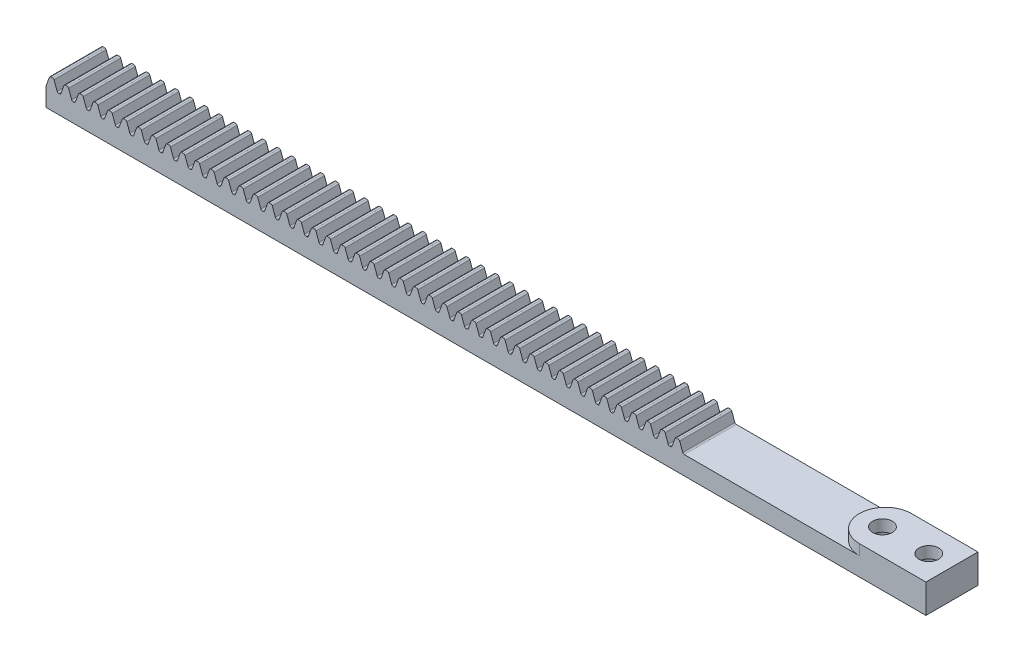
from build123d import *

# Parameters (mm, degrees)
BOSS_EXTRUDE1_DEPTH           = 4.5
BOSS_EXTRUDE1_DEPTH_BACK      = 4.5
SKETCH3_W                     = 304
SKETCH3_H                     = 5
CUT_EXTRUDE1_DEPTH            = 153.124587099
LPATTERN1_COUNT               = 44
LPATTERN1_PITCH               = 2.513274123
SKETCH5_W                     = 193.68028689
SKETCH5_H                     = 1.8
CUT_EXTRUDE2_DEPTH            = 153.324128095
M5_CLEARANCE_HOLE1_D          = 5.5
SKETCH13_W                    = 16
SKETCH13_H                    = 1.8
BOSS_EXTRUDE3_DEPTH           = 4.5
BOSS_EXTRUDE2_DEPTH           = 4.5
CBORE_FOR_M3_SHCS1_AT_2_COUNT = 2
CBORE_FOR_M3_SHCS1_AT_2_PITCH = 8
FILLET1_R                     = 1.6
FILLET3_RADIUS                = 4.5
FILLET3_LENGTH                = 3.2
FILLET4_RADIUS                = 4.5
FILLET4_LENGTH                = 1.8
FILLET2_RADIUS                = 4.5
FILLET2_LENGTH                = 3.2


# Read off the part's stored shape, not the designer's step: Split1
with BuildPart() as part:
    # Sketch3 → Boss-Extrude1 (new, two sides: drawn at the far end of the back side and taken through both)
    with BuildSketch(Plane.XY.offset(-BOSS_EXTRUDE1_DEPTH_BACK)):
        with Locations((0, -1.7)):
            Rectangle(SKETCH3_W, SKETCH3_H)
    extrude(amount=BOSS_EXTRUDE1_DEPTH + BOSS_EXTRUDE1_DEPTH_BACK)

    # Sketch4 → Cut-Extrude1 (cut, symmetric)
    with BuildSketch(Plane.XY):
        with BuildLine():
            Line((-151.409132339, 0.623395556), (-151.344853578, 0.8))
            Line((-151.344853578, 0.8), (-152.264348296, 0.8))
            Line((-152.264348296, 0.8), (-152.264348296, -1))
            Line((-152.264348296, -1), (-152.187938524, -1))
            ThreePointArc((-152.187938524, -1), (-152.033988298, -0.95145968), (-151.935721239, -0.823395556))
            Line((-151.935721239, -0.823395556), (-151.409132339, 0.623395556))
        make_face()
        with BuildLine():
            Line((-151.156915054, 0.8), (-151.344853578, 0.8))
            Line((-151.344853578, 0.8), (-151.409132339, 0.623395556))
            ThreePointArc((-151.409132339, 0.623395556), (-151.31086528, 0.75145968), (-151.156915054, 0.8))
        make_face()
        with BuildLine():
            Line((-150.606290131, 0.623395556), (-150.670568892, 0.8))
            Line((-150.670568892, 0.8), (-150.858507416, 0.8))
            ThreePointArc((-150.858507416, 0.8), (-150.70455719, 0.75145968), (-150.606290131, 0.623395556))
        make_face()
        with BuildLine():
            Line((-149.751074174, -1), (-149.751074174, 0.8))
            Line((-149.751074174, 0.8), (-150.670568892, 0.8))
            Line((-150.670568892, 0.8), (-150.606290131, 0.623395556))
            Line((-150.606290131, 0.623395556), (-150.079701231, -0.823395556))
            ThreePointArc((-150.079701231, -0.823395556), (-149.981434172, -0.95145968), (-149.827483946, -1))
            Line((-149.827483946, -1), (-149.751074174, -1))
        make_face()
    cut_extrude1 = extrude(amount=CUT_EXTRUDE1_DEPTH, both=True, mode=Mode.SUBTRACT)

    # LPattern1: Cut-Extrude1 ×44
    with Locations(*[(i * LPATTERN1_PITCH, 0, 0) for i in range(1, LPATTERN1_COUNT)]):
        add(cut_extrude1, mode=Mode.SUBTRACT)

    # Sketch5 → Cut-Extrude2 (cut, through all)
    with BuildSketch(Plane.XY.offset(4.5)):
        with Locations((55.159856555, -0.1)):
            Rectangle(SKETCH5_W, SKETCH5_H)
    extrude(amount=-CUT_EXTRUDE2_DEPTH, mode=Mode.SUBTRACT)

    # M5 Clearance Hole1 (through all)
    with Locations(Plane(origin=(0, -1, 0), x_dir=(1, 0, 0), z_dir=(0, 1, 0))):
        with Locations((146, 0)):
            Hole(M5_CLEARANCE_HOLE1_D / 2)


with BuildPart() as body_2:
    # Split1: the piece on the far side of the plane
    add(part.part)
    split(bisect_by=Plane.YZ, keep=Keep.BOTTOM)

    # Sketch13 → Boss-Extrude3 (add, symmetric)
    with BuildSketch(Plane.XY):
        with Locations((-8, -0.1)):
            Rectangle(SKETCH13_W, SKETCH13_H)
    extrude(amount=BOSS_EXTRUDE3_DEPTH, both=True)


with BuildPart() as part_1:
    add(part.part)

    # Split1
    split(bisect_by=Plane.YZ, keep=Keep.TOP)

    # Sketch9 → Boss-Extrude2 (add, symmetric)
    with BuildSketch(Plane.XY):
        Polygon((3.2, -1), (3.2, 4), (-16, 4), (-16, 0.8), (0, 0.8), (0, -1), align=None)
    extrude(amount=BOSS_EXTRUDE2_DEPTH, both=True)


with BuildPart() as cbore_for_m3_shcs1_tool:
    # Sketch11 → CBORE for M3 SHCS1 (revolve)
    with BuildSketch(Plane(origin=(-12, -4.2, 0), x_dir=(0, 0, -1), z_dir=(1, 0, 0))):
        Polygon((0, 0), (0, 8.2), (1.7, 8.2), (1.7, 3), (3.25, 3), (3.25, 0.025), (3.275, 0), align=None)
    cbore_for_m3_shcs1 = revolve(axis=Axis((-12, -10.55, 0), (0, 1, 0)))


with BuildPart() as part_2:
    add(part_1.part)

    # CBORE for M3 SHCS1: cut by cbore_for_m3_shcs1_tool
    add(cbore_for_m3_shcs1_tool.part, mode=Mode.SUBTRACT)


with BuildPart() as body_2_1:
    add(body_2.part)

    # CBORE for M3 SHCS1: cut by cbore_for_m3_shcs1_tool
    add(cbore_for_m3_shcs1_tool.part, mode=Mode.SUBTRACT)


with BuildPart() as cbore_for_m3_shcs1_at_2_tool:
    # CBORE for M3 SHCS1 at 2: CBORE for M3 SHCS1 ×2
    with Locations(*[(i * CBORE_FOR_M3_SHCS1_AT_2_PITCH, 0, 0) for i in range(1, CBORE_FOR_M3_SHCS1_AT_2_COUNT)]):
        add(cbore_for_m3_shcs1)


with BuildPart() as part_3:
    add(part_2.part)

    # CBORE for M3 SHCS1 at 2: cut by cbore_for_m3_shcs1_at_2_tool
    add(cbore_for_m3_shcs1_at_2_tool.part, mode=Mode.SUBTRACT)

    # Fillet1
    fillet1_edges = [part_3.edges().sort_by_distance(p)[0] for p in [
        (3.2, -1, 0),
        (3.2, 4, 0),
    ]]
    fillet(fillet1_edges, radius=FILLET1_R)

    # Fillet3: full round fillet: the end face becomes a half cylinder, R = half its width
    fillet3_face = Plane((-16, 2.4, 0), x_dir=(0, -1, 0), z_dir=(-1, 0, 0))  # on the end face: x along it, z out of the body
    fillet3_slab = fillet3_face.offset(-FILLET3_RADIUS / 2) * Box(FILLET3_LENGTH, 2 * FILLET3_RADIUS, FILLET3_RADIUS, mode=Mode.PRIVATE)  # the body's end, R deep
    fillet3_round = Plane((-11.5, 2.4, 0), x_dir=(-1, 0, 0), z_dir=(0, -1, 0)) * Cylinder(FILLET3_RADIUS, FILLET3_LENGTH, mode=Mode.PRIVATE)  # its axis R under the face
    add(fillet3_slab - fillet3_round, mode=Mode.SUBTRACT)

    # Fillet2: full round fillet: the end face becomes a half cylinder, R = half its width
    fillet2_face = Plane((152, -2.6, 0), x_dir=(0, -1, 0), z_dir=(1, 0, 0))  # on the end face: x along it, z out of the body
    fillet2_slab = fillet2_face.offset(-FILLET2_RADIUS / 2) * Box(FILLET2_LENGTH, 2 * FILLET2_RADIUS, FILLET2_RADIUS, mode=Mode.PRIVATE)  # the body's end, R deep
    fillet2_round = Plane((147.5, -2.6, 0), x_dir=(1, 0, 0), z_dir=(0, -1, 0)) * Cylinder(FILLET2_RADIUS, FILLET2_LENGTH, mode=Mode.PRIVATE)  # its axis R under the face
    add(fillet2_slab - fillet2_round, mode=Mode.SUBTRACT)


with BuildPart() as body_2_2:
    add(body_2_1.part)

    # CBORE for M3 SHCS1 at 2: cut by cbore_for_m3_shcs1_at_2_tool
    add(cbore_for_m3_shcs1_at_2_tool.part, mode=Mode.SUBTRACT)

    # Fillet4: full round fillet: the end face becomes a half cylinder, R = half its width
    fillet4_face = Plane((-16, -0.1, 0), x_dir=(0, -1, 0), z_dir=(-1, 0, 0))  # on the end face: x along it, z out of the body
    fillet4_slab = fillet4_face.offset(-FILLET4_RADIUS / 2) * Box(FILLET4_LENGTH, 2 * FILLET4_RADIUS, FILLET4_RADIUS, mode=Mode.PRIVATE)  # the body's end, R deep
    fillet4_round = Plane((-11.5, -0.1, 0), x_dir=(-1, 0, 0), z_dir=(0, -1, 0)) * Cylinder(FILLET4_RADIUS, FILLET4_LENGTH, mode=Mode.PRIVATE)  # its axis R under the face
    add(fillet4_slab - fillet4_round, mode=Mode.SUBTRACT)


solid = body_2_2.part
